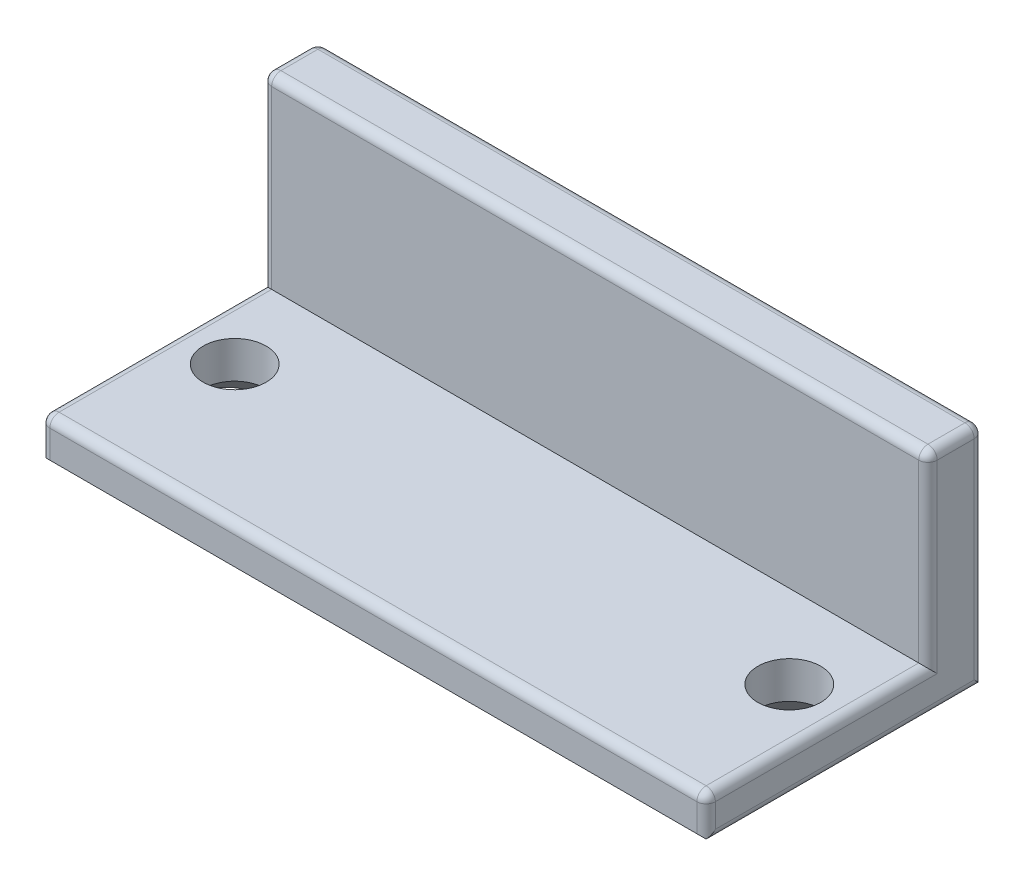
from build123d import *

# Parameters (mm, degrees)
SKETCH_1_W          = 36
SKETCH_1_H          = 15
EXTRUDE_1_DEPTH     = 4
SKETCH_2_W          = 36
SKETCH_2_H          = 3
EXTRUDE_2_DEPTH     = 10
SKETCH_3_R          = 1.7
CUT_EXTRUDE_1_DEPTH = 8
CHAMFER_1_SIZE      = 2
FILLET_1_R          = 0.5
FILLET_2_R          = 0.5


with BuildPart() as part:
    # Эскиз1 → Бобышка-Вытянуть1 (new body)
    with BuildSketch(Plane(origin=(0, 0, 0), x_dir=(1, 0, 0), z_dir=(0, 1, 0))):
        Rectangle(SKETCH_1_W, SKETCH_1_H)
    extrude(amount=EXTRUDE_1_DEPTH)

    # Эскиз2 → Бобышка-Вытянуть2 (add)
    with BuildSketch(Plane(origin=(0, 4, 0), x_dir=(1, 0, 0), z_dir=(0, 1, 0))):
        with Locations((0, 6)):
            Rectangle(SKETCH_2_W, SKETCH_2_H)
    extrude(amount=EXTRUDE_2_DEPTH)

    # Эскиз3 → Вырез-Вытянуть1 (cut)
    with BuildSketch(Plane.XZ):
        with Locations(Location((15, 0, 0), (0, 0, 270))):
            Circle(SKETCH_3_R)
        with Locations(Location((-15, 0, 0), (0, 0, 270))):
            Circle(SKETCH_3_R)
    extrude(amount=-CUT_EXTRUDE_1_DEPTH, mode=Mode.SUBTRACT)

    # Фаска1
    # the kernel refuses this chamfer: 2 mm, written as the material it takes off along each edge
    with BuildSketch(Plane(origin=(15, 0, 0), x_dir=(0, 0, -1), z_dir=(-1, 0, 0))) as chamfer_1_piece_1:
        Polygon((1.7 + CHAMFER_1_SIZE, 0), (1.7, -CHAMFER_1_SIZE), (1.7, 0), align=None)
    revolve(axis=Axis((15, 0, 0), (0, -1, 0)), mode=Mode.SUBTRACT)
    with BuildSketch(Plane(origin=(-15, 0, 0), x_dir=(0, 0, -1), z_dir=(-1, 0, 0))) as chamfer_1_piece_2:
        Polygon((1.7 + CHAMFER_1_SIZE, 0), (1.7, -CHAMFER_1_SIZE), (1.7, 0), align=None)
    revolve(axis=Axis((-15, 0, 0), (0, -1, 0)), mode=Mode.SUBTRACT)
    with BuildSketch(Plane(origin=(-23.143365976, 0, 7.5), x_dir=(0, 0.9996219169112968, 0.027495876610586494), z_dir=(1, 0, 0))) as chamfer_1_piece_3:
        Polygon((CHAMFER_1_SIZE * 0.999621916911, -CHAMFER_1_SIZE * 0.0274958766106), (-CHAMFER_1_SIZE * 0.0274958766106, -CHAMFER_1_SIZE * 0.999621916911), (0, 0), align=None)
    extrude(amount=46.286731952, mode=Mode.SUBTRACT)
    with BuildSketch(Plane(origin=(-18, 0, -12.643365976), x_dir=(-0.02749587661058563, 0.9996219169112968, 0), z_dir=(0, 0, 1)), Plane(origin=(18, 0, 12.643365976), x_dir=(0.02749587661058563, 0.9996219169112968, 0), z_dir=(0, 0, -1))) as chamfer_1_piece_4:
        Polygon((CHAMFER_1_SIZE * 0.999621916911, -CHAMFER_1_SIZE * 0.0274958766106), (-CHAMFER_1_SIZE * 0.0274958766106, -CHAMFER_1_SIZE * 0.999621916911), (0, 0), align=None)
    extrude(amount=25.286731952, mode=Mode.SUBTRACT)
    with BuildSketch(Plane(origin=(23.143365976, 0, -7.5), x_dir=(0, -0.027495876610586365, 0.9996219169112968), z_dir=(-1, 0, 0))) as chamfer_1_piece_5:
        Polygon((CHAMFER_1_SIZE * 0.999621916911, CHAMFER_1_SIZE * 0.0274958766106), (-CHAMFER_1_SIZE * 0.0274958766106, CHAMFER_1_SIZE * 0.999621916911), (0, 0), align=None)
    extrude(amount=46.286731952, mode=Mode.SUBTRACT)

    # Скругление1
    # the kernel refuses this fillet: 0.5 mm, written as the material it takes off along each edge
    with BuildSketch(Plane(origin=(-17.5, 13.5, -5), x_dir=(0, 0, 1), z_dir=(0, 1, 0))) as fillet_1_piece_1_section:
        Polygon((0, 0), (FILLET_1_R, 0), (FILLET_1_R, -FILLET_1_R), (0, -FILLET_1_R), align=None)
    fillet_1_piece_1 = extrude(amount=FILLET_1_R, mode=Mode.PRIVATE)
    fillet_1_piece_1 = fillet_1_piece_1 - Plane(origin=(-17.5, 13.5, -5), x_dir=(0.7071067811865475, 0, -0.7071067811865475), z_dir=(0, 1, 0)) * Sphere(FILLET_1_R, mode=Mode.PRIVATE)
    add(fillet_1_piece_1, mode=Mode.SUBTRACT)
    with BuildSketch(Plane(origin=(17.5, 13.5, -5), x_dir=(1, 0, 0), z_dir=(0, 1, 0))) as fillet_1_piece_2_section:
        Polygon((0, 0), (FILLET_1_R, 0), (FILLET_1_R, -FILLET_1_R), (0, -FILLET_1_R), align=None)
    fillet_1_piece_2 = extrude(amount=FILLET_1_R, mode=Mode.PRIVATE)
    fillet_1_piece_2 = fillet_1_piece_2 - Plane(origin=(17.5, 13.5, -5), x_dir=(-0.7071067811865475, 0, -0.7071067811865475), z_dir=(0, 1, 0)) * Sphere(FILLET_1_R, mode=Mode.PRIVATE)
    add(fillet_1_piece_2, mode=Mode.SUBTRACT)
    with BuildSketch(Plane(origin=(-17.5, 13.5, -7), x_dir=(0, 1, 0), z_dir=(0, 0, -1))) as fillet_1_piece_3_section:
        Polygon((0, 0), (FILLET_1_R, 0), (FILLET_1_R, -FILLET_1_R), (0, -FILLET_1_R), align=None)
    fillet_1_piece_3 = extrude(amount=FILLET_1_R, mode=Mode.PRIVATE)
    fillet_1_piece_3 = fillet_1_piece_3 - Plane(origin=(-17.5, 13.5, -7), x_dir=(0.7071067811865475, -0.7071067811865475, 0), z_dir=(0, 0, -1)) * Sphere(FILLET_1_R, mode=Mode.PRIVATE)
    add(fillet_1_piece_3, mode=Mode.SUBTRACT)
    with BuildSketch(Plane(origin=(17.5, 13.5, -7), x_dir=(0, 1, 0), z_dir=(0, 0, -1))) as fillet_1_piece_4_section:
        Polygon((0, 0), (FILLET_1_R, 0), (FILLET_1_R, FILLET_1_R), (0, FILLET_1_R), align=None)
    fillet_1_piece_4 = extrude(amount=FILLET_1_R, mode=Mode.PRIVATE)
    fillet_1_piece_4 = fillet_1_piece_4 - Plane(origin=(17.5, 13.5, -7), x_dir=(-0.7071067811865475, -0.7071067811865475, 0), z_dir=(0, 0, -1)) * Sphere(FILLET_1_R, mode=Mode.PRIVATE)
    add(fillet_1_piece_4, mode=Mode.SUBTRACT)
    with BuildSketch(Plane(origin=(-18, 4, -4.5), x_dir=(1, 0, 0), z_dir=(0, 0, 1))) as fillet_1_piece_5:
        with BuildLine():
            CenterArc((FILLET_1_R, -FILLET_1_R), FILLET_1_R, 90, 90)
            Line((0, -FILLET_1_R), (0, 0))
            Line((0, 0), (FILLET_1_R, 0))
        make_face()
    extrude(amount=13.25, mode=Mode.SUBTRACT)
    with BuildSketch(Plane(origin=(-18, 4, -4.5), x_dir=(0, 0, -1), z_dir=(0, 1, 0))) as fillet_1_piece_6:
        with BuildLine():
            CenterArc((FILLET_1_R, -FILLET_1_R), FILLET_1_R, 90, 90)
            Line((0, -FILLET_1_R), (0, 0))
            Line((0, 0), (FILLET_1_R, 0))
        make_face()
    extrude(amount=9.5, mode=Mode.SUBTRACT)
    with BuildSketch(Plane(origin=(18, 4, -4.5), x_dir=(0, 0, -1), z_dir=(0, 1, 0))) as fillet_1_piece_7:
        with BuildLine():
            CenterArc((FILLET_1_R, FILLET_1_R), FILLET_1_R, 180, 90)
            Line((0, FILLET_1_R), (0, 0))
            Line((0, 0), (FILLET_1_R, 0))
        make_face()
    extrude(amount=9.5, mode=Mode.SUBTRACT)
    with BuildSketch(Plane(origin=(-18, 14, -5), x_dir=(0, -1, 0), z_dir=(0, 0, -1)), Plane(origin=(18, 14, -7), x_dir=(0, -1, 0), z_dir=(0, 0, 1))) as fillet_1_piece_8:
        with BuildLine():
            CenterArc((FILLET_1_R, -FILLET_1_R), FILLET_1_R, 90, 90)
            Line((0, -FILLET_1_R), (0, 0))
            Line((0, 0), (FILLET_1_R, 0))
        make_face()
    extrude(amount=2, mode=Mode.SUBTRACT)
    with BuildSketch(Plane(origin=(17.5, 14, -4.5), x_dir=(0, 0, -1), z_dir=(-1, 0, 0))) as fillet_1_piece_9:
        with BuildLine():
            CenterArc((FILLET_1_R, FILLET_1_R), FILLET_1_R, 180, 90)
            Line((0, FILLET_1_R), (0, 0))
            Line((0, 0), (FILLET_1_R, 0))
        make_face()
    extrude(amount=35, mode=Mode.SUBTRACT)
    with BuildSketch(Plane(origin=(-17.5, 14, -7.5), x_dir=(0, -1, 0), z_dir=(1, 0, 0))) as fillet_1_piece_10:
        with BuildLine():
            CenterArc((FILLET_1_R, -FILLET_1_R), FILLET_1_R, 90, 90)
            Line((0, -FILLET_1_R), (0, 0))
            Line((0, 0), (FILLET_1_R, 0))
        make_face()
    extrude(amount=35, mode=Mode.SUBTRACT)
    with BuildSketch(Plane(origin=(-18, 2, -8.017766953), x_dir=(0, 1, 0), z_dir=(0, 0, 1)), Plane(origin=(18, 2, 8.017766953), x_dir=(0, 1, 0), z_dir=(0, 0, -1))) as fillet_1_piece_11:
        with BuildLine():
            CenterArc((FILLET_1_R * 0.414213562373, -FILLET_1_R), FILLET_1_R, 90, 45)
            Line((-FILLET_1_R * 0.292893218814, -FILLET_1_R * 0.292893218814), (0, 0))
            Line((0, 0), (FILLET_1_R * 0.414213562373, 0))
        make_face()
    extrude(amount=16.035533906, mode=Mode.SUBTRACT)
    with BuildSketch(Plane(origin=(18, 4, 8.75), x_dir=(0, -1, 0), z_dir=(0, 0, -1))) as fillet_1_piece_12:
        with BuildLine():
            CenterArc((FILLET_1_R, FILLET_1_R), FILLET_1_R, 180, 90)
            Line((0, FILLET_1_R), (0, 0))
            Line((0, 0), (FILLET_1_R, 0))
        make_face()
    extrude(amount=13.25, mode=Mode.SUBTRACT)
    with BuildSketch(Plane(origin=(18, 0.75, 7.5), x_dir=(-1, 0, 0), z_dir=(0, 1, 0))) as fillet_1_piece_13:
        with BuildLine():
            CenterArc((FILLET_1_R, -FILLET_1_R), FILLET_1_R, 90, 90)
            Line((0, -FILLET_1_R), (0, 0))
            Line((0, 0), (FILLET_1_R, 0))
        make_face()
    extrude(amount=4.5, mode=Mode.SUBTRACT)
    with BuildSketch(Plane(origin=(-18, 0.75, 7.5), x_dir=(1, 0, 0), z_dir=(0, 1, 0))) as fillet_1_piece_14:
        with BuildLine():
            CenterArc((FILLET_1_R, FILLET_1_R), FILLET_1_R, 180, 90)
            Line((0, FILLET_1_R), (0, 0))
            Line((0, 0), (FILLET_1_R, 0))
        make_face()
    extrude(amount=4.5, mode=Mode.SUBTRACT)
    with BuildSketch(Plane(origin=(-18, 13.5, -7.5), x_dir=(0, 0, 1), z_dir=(0, -1, 0)), Plane(origin=(18, 0.75, -7.5), x_dir=(0, 0, 1), z_dir=(0, 1, 0))) as fillet_1_piece_15:
        with BuildLine():
            CenterArc((FILLET_1_R, -FILLET_1_R), FILLET_1_R, 90, 90)
            Line((0, -FILLET_1_R), (0, 0))
            Line((0, 0), (FILLET_1_R, 0))
        make_face()
    extrude(amount=12.75, mode=Mode.SUBTRACT)
    with BuildSketch(Plane(origin=(-18, 4, -5.75), x_dir=(1, 0, 0), z_dir=(0, 0, 1))) as fillet_1_piece_16a_section:
        with BuildLine():
            CenterArc((FILLET_1_R, -FILLET_1_R), FILLET_1_R, 90, 90)
            Line((0, -FILLET_1_R), (0, 0))
            Line((0, 0), (FILLET_1_R, 0))
        make_face()
    fillet_1_piece_16a = extrude(amount=14.5, mode=Mode.PRIVATE)
    fillet_1_piece_16a = split(fillet_1_piece_16a, bisect_by=Plane(origin=(-17.886802443, 3.886802443, -4.5), z_dir=(0, 0, -1)), keep=Keep.TOP, mode=Mode.PRIVATE)
    with BuildSketch(Plane(origin=(-18, 2.75, -4.5), x_dir=(0, 0, -1), z_dir=(0, 1, 0))) as fillet_1_piece_16b_section:
        with BuildLine():
            CenterArc((FILLET_1_R, -FILLET_1_R), FILLET_1_R, 90, 90)
            Line((0, -FILLET_1_R), (0, 0))
            Line((0, 0), (FILLET_1_R, 0))
        make_face()
    fillet_1_piece_16b = extrude(amount=10.75, mode=Mode.PRIVATE)
    fillet_1_piece_16b = split(fillet_1_piece_16b, bisect_by=Plane(origin=(-17.886802443, 4, -4.613197557), z_dir=(0, -1, 0)), keep=Keep.TOP, mode=Mode.PRIVATE)
    fillet_1_piece_16 = fillet_1_piece_16a & fillet_1_piece_16b
    add(fillet_1_piece_16, mode=Mode.SUBTRACT)
    with BuildSketch(Plane(origin=(18, 2.75, -4.5), x_dir=(0, 0, -1), z_dir=(0, 1, 0))) as fillet_1_piece_17a_section:
        with BuildLine():
            CenterArc((FILLET_1_R, FILLET_1_R), FILLET_1_R, 180, 90)
            Line((0, FILLET_1_R), (0, 0))
            Line((0, 0), (FILLET_1_R, 0))
        make_face()
    fillet_1_piece_17a = extrude(amount=10.75, mode=Mode.PRIVATE)
    fillet_1_piece_17a = split(fillet_1_piece_17a, bisect_by=Plane(origin=(17.886802443, 4, -4.613197557), z_dir=(0, -1, 0)), keep=Keep.TOP, mode=Mode.PRIVATE)
    with BuildSketch(Plane(origin=(18, 4, 8.75), x_dir=(0, -1, 0), z_dir=(0, 0, -1))) as fillet_1_piece_17b_section:
        with BuildLine():
            CenterArc((FILLET_1_R, FILLET_1_R), FILLET_1_R, 180, 90)
            Line((0, FILLET_1_R), (0, 0))
            Line((0, 0), (FILLET_1_R, 0))
        make_face()
    fillet_1_piece_17b = extrude(amount=14.5, mode=Mode.PRIVATE)
    fillet_1_piece_17b = split(fillet_1_piece_17b, bisect_by=Plane(origin=(17.886802443, 3.886802443, -4.5), z_dir=(0, 0, -1)), keep=Keep.TOP, mode=Mode.PRIVATE)
    fillet_1_piece_17 = fillet_1_piece_17a & fillet_1_piece_17b
    add(fillet_1_piece_17, mode=Mode.SUBTRACT)

    # Скругление2
    # the kernel refuses this fillet: 0.5 mm, written as the material it takes off along each edge
    with BuildSketch(Plane(origin=(17.5, 3.5, 7), x_dir=(0, 1, 0), z_dir=(0, 0, 1))) as fillet_2_piece_1_section:
        Polygon((0, 0), (FILLET_2_R, 0), (FILLET_2_R, -FILLET_2_R), (0, -FILLET_2_R), align=None)
    fillet_2_piece_1 = extrude(amount=FILLET_2_R, mode=Mode.PRIVATE)
    fillet_2_piece_1 = fillet_2_piece_1 - Plane(origin=(17.5, 3.5, 7), x_dir=(-0.7071067811865475, -0.7071067811865475, 0), z_dir=(0, 0, 1)) * Sphere(FILLET_2_R, mode=Mode.PRIVATE)
    add(fillet_2_piece_1, mode=Mode.SUBTRACT)
    with BuildSketch(Plane(origin=(-17.5, 3.5, 7), x_dir=(0, 1, 0), z_dir=(0, 0, 1))) as fillet_2_piece_2_section:
        Polygon((0, 0), (FILLET_2_R, 0), (FILLET_2_R, FILLET_2_R), (0, FILLET_2_R), align=None)
    fillet_2_piece_2 = extrude(amount=FILLET_2_R, mode=Mode.PRIVATE)
    fillet_2_piece_2 = fillet_2_piece_2 - Plane(origin=(-17.5, 3.5, 7), x_dir=(0.7071067811865475, -0.7071067811865475, 0), z_dir=(0, 0, 1)) * Sphere(FILLET_2_R, mode=Mode.PRIVATE)
    add(fillet_2_piece_2, mode=Mode.SUBTRACT)
    with BuildSketch(Plane(origin=(-17.5, 4, 7.5), x_dir=(0, -1, 0), z_dir=(1, 0, 0))) as fillet_2_piece_3:
        with BuildLine():
            CenterArc((FILLET_2_R, FILLET_2_R), FILLET_2_R, 180, 90)
            Line((0, FILLET_2_R), (0, 0))
            Line((0, 0), (FILLET_2_R, 0))
        make_face()
    extrude(amount=35, mode=Mode.SUBTRACT)


solid = part.part
